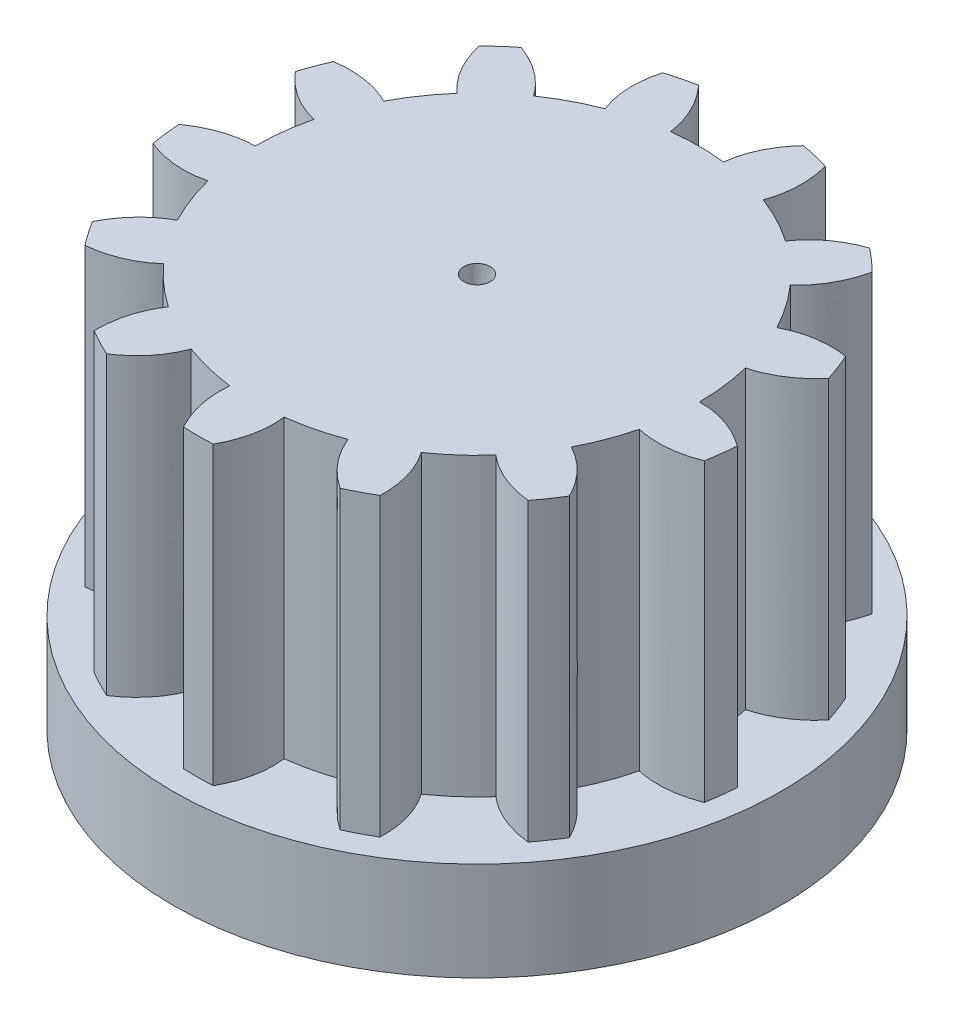
from build123d import *
from OCP.BRepAlgoAPI import BRepAlgoAPI_Cut
from OCP.TopTools import TopTools_ListOfShape

# Parameters (mm, degrees)
SKETCH1_R           = 0.4
BOSS_EXTRUDE1_DEPTH = 9
SKETCH2_R           = 9.25
BOSS_EXTRUDE2_DEPTH = 3
SCALE1_SCALE        = 1.8
CUT_EXTRUDE1_DEPTH  = 2


with BuildPart() as part:
    # Sketch1 → Boss-Extrude1 (new body)
    with BuildSketch(Plane(origin=(0, 0, 0), x_dir=(1, 0, 0), z_dir=(0, 1, 0))):
        with BuildLine():
            add(Edge.make_bspline(
                [(-5.065227978, 4.461610195), (-5.526615005, 4.86619147), (-5.830003112, 5.39406146), (-5.975392301, 6.045220165)],
                knots=[0, 0, 0, 0, 0.872429449, 0.872429449, 0.872429449, 0.872429449], degree=3))
            ThreePointArc((-5.065227978, 4.461610195), (-5.560258819, 3.827012132), (-5.976238464, 3.138004752))
            add(Edge.make_bspline(
                [(-7.780961116, 3.42149735), (-7.125870497, 3.507536778), (-6.52429628, 3.413039245), (-5.976238464, 3.138004752)],
                knots=[0.127683247, 0.127683247, 0.127683247, 0.127683247, 1, 1, 1, 1], degree=3))
            ThreePointArc((-7.780961116, 3.42149735), (-7.951879756, 3.00293329), (-8.10030101, 2.575873357))
            add(Edge.make_bspline(
                [(-6.558450277, 1.596630818), (-7.155006493, 1.740452504), (-7.668956737, 2.066866683), (-8.10030101, 2.575873357)],
                knots=[0, 0, 0, 0, 0.872429449, 0.872429449, 0.872429449, 0.872429449], degree=3))
            ThreePointArc((-6.558450277, 1.596630818), (-6.701865893, 0.804669837), (-6.749999881, 0.00126872))
            add(Edge.make_bspline(
                [(-8.479748007, -0.586407486), (-7.939678588, -0.205787566), (-7.363095879, -0.009895497), (-6.749999881, 0.00126872)],
                knots=[0.127683247, 0.127683247, 0.127683247, 0.127683247, 1, 1, 1, 1], degree=3))
            ThreePointArc((-8.479748007, -0.586407486), (-8.436572529, -1.036457408), (-8.369528376, -1.483574994))
            add(Edge.make_bspline(
                [(-6.549210655, -1.634117437), (-7.144272221, -1.784003157), (-7.751044795, -1.733822342), (-8.369528376, -1.483574994)],
                knots=[0, 0, 0, 0, 0.872429449, 0.872429449, 0.872429449, 0.872429449], degree=3))
            ThreePointArc((-6.549210655, -1.634117437), (-6.308156258, -2.402012621), (-5.977417671, -3.13575796))
            add(Edge.make_bspline(
                [(-7.235926822, -4.459973434), (-6.934601997, -3.871968458), (-6.515098947, -3.4305633), (-5.977417671, -3.13575796)],
                knots=[0.127683247, 0.127683247, 0.127683247, 0.127683247, 1, 1, 1, 1], degree=3))
            ThreePointArc((-7.235926822, -4.459973434), (-6.988548208, -4.838408204), (-6.721397655, -5.203154193))
            add(Edge.make_bspline(
                [(-5.039625799, -4.490509081), (-5.496871281, -4.899765193), (-6.0574619, -5.137313564), (-6.721397655, -5.203154193)],
                knots=[0, 0, 0, 0, 0.872429449, 0.872429449, 0.872429449, 0.872429449], degree=3))
            ThreePointArc((-5.039625799, -4.490509081), (-4.469324045, -5.058422935), (-3.835481109, -5.554420281))
            add(Edge.make_bspline(
                [(-4.334442004, -7.311813216), (-4.34089166, -6.651128039), (-4.174571361, -6.065330394), (-3.835481109, -5.554420281)],
                knots=[0.127683247, 0.127683247, 0.127683247, 0.127683247, 1, 1, 1, 1], degree=3))
            ThreePointArc((-4.334442004, -7.311813216), (-3.939531713, -7.53193799), (-3.533475733, -7.730753472))
            add(Edge.make_bspline(
                [(-2.375523406, -6.318179211), (-2.590203375, -6.893050073), (-2.976187484, -7.36390816), (-3.533475733, -7.730753472)],
                knots=[0, 0, 0, 0, 0.872429449, 0.872429449, 0.872429449, 0.872429449], degree=3))
            ThreePointArc((-2.375523406, -6.318179211), (-1.606623554, -6.556009515), (-0.814882047, -6.700631854))
            add(Edge.make_bspline(
                [(-0.439988759, -8.488604708), (-0.752735357, -7.906594341), (-0.877699786, -7.31060339), (-0.814882047, -6.700631854)],
                knots=[0.127683247, 0.127683247, 0.127683247, 0.127683247, 1, 1, 1, 1], degree=3))
            ThreePointArc((-0.439988759, -8.488604708), (0.011984021, -8.499991552), (0.463922896, -8.487330296))
            add(Edge.make_bspline(
                [(0.832782771, -6.698430626), (0.909848909, -7.307220251), (0.786895617, -7.903520141), (0.463922896, -8.487330296)],
                knots=[0, 0, 0, 0, 0.872429449, 0.872429449, 0.872429449, 0.872429449], degree=3))
            ThreePointArc((0.832782771, -6.698430626), (1.624135031, -6.551693323), (2.392396671, -6.311809421))
            add(Edge.make_bspline(
                [(3.555260608, -7.72075916), (3.007863545, -7.350755165), (2.620242233, -6.881105252), (2.392396671, -6.311809421)],
                knots=[0.127683247, 0.127683247, 0.127683247, 0.127683247, 1, 1, 1, 1], degree=3))
            ThreePointArc((3.555260608, -7.72075916), (3.96075436, -7.520799485), (4.355042381, -7.299562032))
            add(Edge.make_bspline(
                [(3.850308451, -5.54415231), (4.201465773, -6.047394331), (4.369710416, -6.632530905), (4.355042381, -7.299562032)],
                knots=[0, 0, 0, 0, 0.872429449, 0.872429449, 0.872429449, 0.872429449], degree=3))
            ThreePointArc((3.850308451, -5.54415231), (4.482823853, -5.046463148), (5.051606144, -4.477027515))
            add(Edge.make_bspline(
                [(6.736042616, -5.184180734), (6.079397157, -5.110946566), (5.517918333, -4.875228826), (5.051606144, -4.477027515)],
                knots=[0.127683247, 0.127683247, 0.127683247, 0.127683247, 1, 1, 1, 1], degree=3))
            ThreePointArc((6.736042616, -5.184180734), (7.002163607, -4.818682892), (7.24847414, -4.439552076))
            add(Edge.make_bspline(
                [(5.985774866, -3.119775513), (6.530577461, -3.402183249), (6.951477219, -3.84210877), (7.24847414, -4.439552076)],
                knots=[0, 0, 0, 0, 0.872429449, 0.872429449, 0.872429449, 0.872429449], degree=3))
            ThreePointArc((5.985774866, -3.119775513), (6.314551754, -2.385149082), (6.553553527, -1.616612559))
            add(Edge.make_bspline(
                [(8.373678438, -1.459968977), (7.758214146, -1.700281702), (7.151505842, -1.75249623), (6.553553527, -1.616612559)],
                knots=[0.127683247, 0.127683247, 0.127683247, 0.127683247, 1, 1, 1, 1], degree=3))
            ThreePointArc((8.373678438, -1.459968977), (8.439461558, -1.01266412), (8.481367828, -0.562494242))
            add(Edge.make_bspline(
                [(6.749972396, 0.019304256), (7.363612555, 0.022427015), (7.940744366, -0.171505818), (8.481367828, -0.562494242)],
                knots=[0, 0, 0, 0, 0.872429449, 0.872429449, 0.872429449, 0.872429449], degree=3))
            ThreePointArc((6.749972396, 0.019304256), (6.699691947, 0.822573894), (6.554160776, 1.614148852))
            add(Edge.make_bspline(
                [(8.093005444, 2.598704077), (7.65971777, 2.099897208), (7.146769547, 1.771712133), (6.554160776, 1.614148852)],
                knots=[0.127683247, 0.127683247, 0.127683247, 0.127683247, 1, 1, 1, 1], degree=3))
            ThreePointArc((8.093005444, 2.598704077), (7.943380571, 3.025343799), (7.771282357, 3.443424244))
            add(Edge.make_bspline(
                [(5.967832596, 3.153961653), (6.509732754, 3.44189952), (7.110882674, 3.53838705), (7.771282357, 3.443424244)],
                knots=[0, 0, 0, 0, 0.872429449, 0.872429449, 0.872429449, 0.872429449], degree=3))
            ThreePointArc((5.967832596, 3.153961653), (5.550013455, 3.841855105), (5.053288778, 4.475128213))
            add(Edge.make_bspline(
                [(5.958322434, 6.062045345), (5.806472362, 5.419014975), (5.504794477, 4.890042598), (5.053288778, 4.475128213)],
                knots=[0.127683247, 0.127683247, 0.127683247, 0.127683247, 1, 1, 1, 1], degree=3))
            ThreePointArc((5.958322434, 6.062045345), (5.627566824, 6.370281912), (5.280889753, 6.660495734))
            add(Edge.make_bspline(
                [(3.818534268, 5.566084444), (4.16455163, 6.072874324), (4.652003458, 6.437678087), (5.280889753, 6.660495734)],
                knots=[0, 0, 0, 0, 0.872429449, 0.872429449, 0.872429449, 0.872429449], degree=3))
            ThreePointArc((3.818534268, 5.566084444), (3.128893766, 5.98101361), (2.394769219, 6.310909632))
            add(Edge.make_bspline(
                [(2.45865956, 8.136645081), (2.623034112, 7.496701718), (2.601737332, 6.888123235), (2.394769219, 6.310909632)],
                knots=[0.127683247, 0.127683247, 0.127683247, 0.127683247, 1, 1, 1, 1], degree=3))
            ThreePointArc((2.45865956, 8.136645081), (2.022545337, 8.25586521), (1.580708948, 8.351727918))
            add(Edge.make_bspline(
                [(0.794455758, 6.703084368), (0.865321915, 7.312626807), (1.127406312, 7.862174657), (1.580708948, 8.351727918)],
                knots=[0, 0, 0, 0, 0.872429449, 0.872429449, 0.872429449, 0.872429449], degree=3))
            ThreePointArc((0.794455758, 6.703084368), (-0.009017778, 6.749993976), (-0.812363108, 6.700937709))
            add(Edge.make_bspline(
                [(-1.604252589, 8.347237485), (-1.161309642, 7.856984441), (-0.897346481, 7.308217849), (-0.812363108, 6.700937709)],
                knots=[0.127683247, 0.127683247, 0.127683247, 0.127683247, 1, 1, 1, 1], degree=3))
            ThreePointArc((-1.604252589, 8.347237485), (-2.045816912, 8.250129282), (-2.481593228, 8.129679886))
            add(Edge.make_bspline(
                [(-2.411622992, 6.304488444), (-2.632142622, 6.877144615), (-2.655466033, 7.485541762), (-2.481593228, 8.129679886)],
                knots=[0, 0, 0, 0, 0.872429449, 0.872429449, 0.872429449, 0.872429449], degree=3))
            ThreePointArc((-2.411622992, 6.304488444), (-3.144863458, 5.972632069), (-3.833392837, 5.555861712))
            add(Edge.make_bspline(
                [(-5.299649804, 6.645578377), (-4.679611352, 6.417326717), (-4.19085903, 6.054087828), (-3.833392837, 5.555861712)],
                knots=[0.127683247, 0.127683247, 0.127683247, 0.127683247, 1, 1, 1, 1], degree=3))
            ThreePointArc((-5.299649804, 6.645578377), (-5.645507162, 6.35438816), (-5.975392301, 6.045220165))
        make_face()
        Circle(SKETCH1_R, mode=Mode.SUBTRACT)
    extrude(amount=BOSS_EXTRUDE1_DEPTH)

    # Sketch2 → Boss-Extrude2 (add)
    with BuildSketch(Plane.XZ):
        Circle(SKETCH2_R)
    extrude(amount=BOSS_EXTRUDE2_DEPTH)


with BuildPart() as part_1:
    # Scale1: scaled about (0, 2.477742253, 0)
    add(part.part.scale(SCALE1_SCALE).moved(Location((0, -1.982193802, 0))))


with BuildPart() as cut_extrude1_tool:
    # Sketch3 → Cut-Extrude1 (new body)
    with BuildSketch(Plane.XZ.offset(7.382189851)):
        with BuildLine():
            Line((-10.14806543, 10.074005921), (-0.183742843, 3.445103564))
            ThreePointArc((-0.183742843, 3.445103564), (2.064801156, 2.763891493), (3.355756213, 0.800874672))
            Line((3.355756213, 0.800874672), (12.53847182, -6.874267357))
            ThreePointArc((12.53847182, -6.874267357), (12.858103903, -9.605814074), (10.14806543, -10.074005921))
            Line((10.14806543, -10.074005921), (0.183742843, -3.445103564))
            ThreePointArc((0.183742843, -3.445103564), (-2.064801156, -2.763891493), (-3.355756213, -0.800874672))
            Line((-3.355756213, -0.800874672), (-12.53847182, 6.874267357))
            ThreePointArc((-12.53847182, 6.874267357), (-12.858103903, 9.605814074), (-10.14806543, 10.074005921))
        make_face()
    extrude(amount=-CUT_EXTRUDE1_DEPTH)


with BuildPart() as part_2:
    add(part_1.part)

    # Cut-Extrude1: cut by cut_extrude1_tool, with a tolerance
    cut_extrude1_stock = TopTools_ListOfShape()
    cut_extrude1_stock.Append(part_2.part.wrapped)
    cut_extrude1_tools = TopTools_ListOfShape()
    cut_extrude1_tools.Append(cut_extrude1_tool.part.wrapped)
    cut_extrude1_cut = BRepAlgoAPI_Cut()
    cut_extrude1_cut.SetArguments(cut_extrude1_stock)
    cut_extrude1_cut.SetTools(cut_extrude1_tools)
    cut_extrude1_cut.SetFuzzyValue(0.00001)
    cut_extrude1_cut.Build()
    add(Compound.cast(cut_extrude1_cut.Shape()).solids(), mode=Mode.REPLACE)


solid = part_2.part
